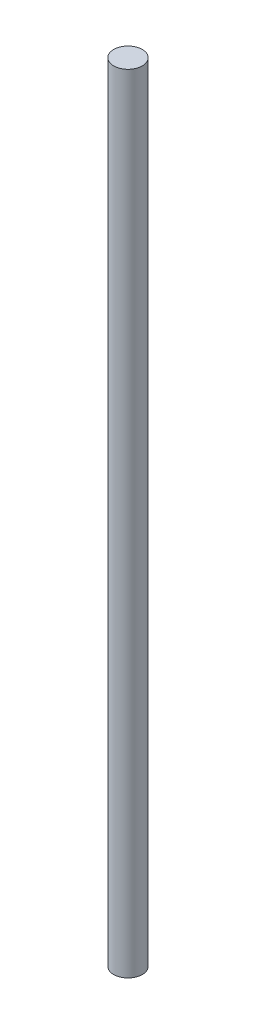
from build123d import *

# Parameters (mm, degrees)
SKETCH1_R           = 3.175
BOSS_EXTRUDE1_DEPTH = 174.953000106


with BuildPart() as part:
    # Sketch1 → Boss-Extrude1 (new body)
    with BuildSketch(Plane(origin=(0, 0, 0), x_dir=(1, 0, 0), z_dir=(0, 1, 0))):
        Circle(SKETCH1_R)
    extrude(amount=BOSS_EXTRUDE1_DEPTH)


solid = part.part
